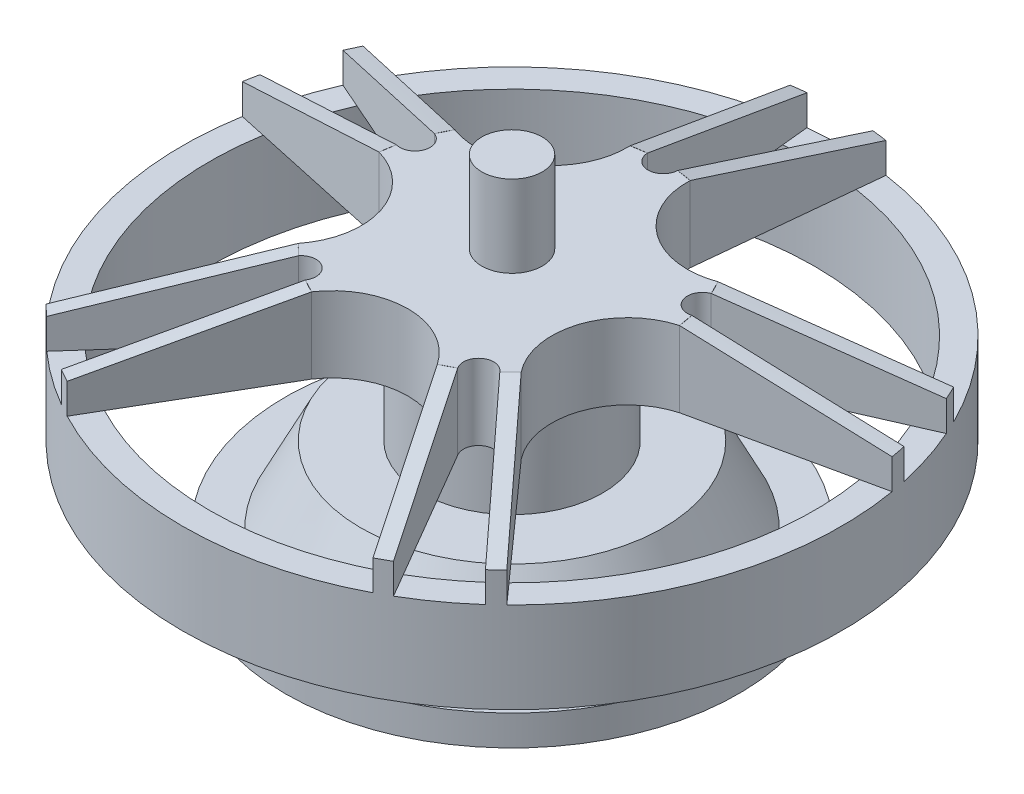
from build123d import *

# Parameters (mm, degrees)
SKETCH_4_R               = 15
EXTRUDE_2_DEPTH          = 2
EXTRUDE_3_DEPTH          = 21.4
EXTRUDE_3_DEPTH_BACK     = 4.1
SKETCH_5_R               = 2
SKETCH_9_W               = 1.8
SKETCH_9_H               = 6
SKETCH_10_R              = 6
SKETCH_10_R_2            = 2
EXTRUDE_5_DEPTH          = 6
SKETCH_11_R              = 2
EXTRUDE_6_DEPTH          = 5
EXTRUDE_7_DEPTH          = 5
PATTERN_START            = 13
PATTERN_CIRCULAR_1_DEPTH = 5


# Read off the part's stored shape, not the designer's step: 阵列(圆周)1
with BuildPart() as part:
    # 草图4 → 凸台-拉伸2 (new body)
    with BuildSketch(Plane(origin=(0, 0, 0), x_dir=(1, 0, 0), z_dir=(0, 1, 0))):
        with Locations(Location((0, 0, 0), (0, 0, 270))):
            Circle(SKETCH_4_R)
    extrude(amount=EXTRUDE_2_DEPTH)

    # 草图5 → 凸台-拉伸3 (add, two sides: drawn at the far end of the back side and taken through both)
    with BuildSketch(Plane(origin=(0, 2, 0), x_dir=(1, 0, 0), z_dir=(0, 1, 0)).offset(-EXTRUDE_3_DEPTH_BACK)):
        with Locations(Location((0, 0, 0), (0, 0, 270))):
            Circle(SKETCH_5_R)
    extrude(amount=EXTRUDE_3_DEPTH + EXTRUDE_3_DEPTH_BACK)

    # 草图8 → 旋转2 (revolve)
    with BuildSketch(Plane.XY, mode=Mode.PRIVATE) as revolve_2_sk:
        Polygon((2, 2), (2, 7), (10, 7), (12.5, 2), align=None)
    revolve(revolve_2_sk.sketch.rotate(Axis((0, 58, 0), (0, -1, 0)), 90), axis=Axis((0, 58, 0), (0, -1, 0)))

    # 草图10 → 凸台-拉伸5 (add)
    with BuildSketch(Plane(origin=(0, 7, 0), x_dir=(1, 0, 0), z_dir=(0, 1, 0))):
        with Locations(Location((0, 0, 0), (0, 0, 90))):
            Circle(SKETCH_10_R)
        with Locations(Location((0, 0, 0), (0, 0, 270))):
            Circle(SKETCH_10_R_2, mode=Mode.SUBTRACT)
    extrude(amount=EXTRUDE_5_DEPTH)

    # 草图11 → 凸台-拉伸6 (add)
    with BuildSketch(Plane(origin=(0, 13, 0), x_dir=(1, 0, 0), z_dir=(0, 1, 0))):
        with BuildLine():
            Line((0.998749218, 9.95), (1.987510943, 9.8005))
            ThreePointArc((1.987510943, 9.8005), (4.045053686, 5.567538761), (8.70665473, 4.918756287))
            Line((8.70665473, 4.918756287), (9.154381856, 4.024586046))
            ThreePointArc((9.154381856, 4.024586046), (8.559508647, 2.781152949), (9.771642819, 2.124852142))
            Line((9.771642819, 2.124852142), (9.935004046, 1.138285819))
            ThreePointArc((9.935004046, 1.138285819), (6.54503435, -2.126610573), (7.368519495, -6.760541432))
            Line((7.368519495, -6.760541432), (6.656468351, -7.462669033))
            ThreePointArc((6.656468351, -7.462669033), (5.290067271, -7.281152949), (5.04045817, -8.636769155))
            Line((5.04045817, -8.636769155), (4.152659235, -9.097000675))
            ThreePointArc((4.152659235, -9.097000675), (0, -6.881856376), (-4.152659235, -9.097000675))
            Line((-4.152659235, -9.097000675), (-5.04045817, -8.636769155))
            ThreePointArc((-5.04045817, -8.636769155), (-5.290067271, -7.281152949), (-6.656468351, -7.462669033))
            Line((-6.656468351, -7.462669033), (-7.368519495, -6.760541432))
            ThreePointArc((-7.368519495, -6.760541432), (-6.54503435, -2.126610573), (-9.935004046, 1.138285819))
            Line((-9.935004046, 1.138285819), (-9.771642819, 2.124852142))
            ThreePointArc((-9.771642819, 2.124852142), (-8.559508647, 2.781152949), (-9.154381856, 4.024586046))
            Line((-9.154381856, 4.024586046), (-8.70665473, 4.918756287))
            ThreePointArc((-8.70665473, 4.918756287), (-4.045053686, 5.567538761), (-1.987510943, 9.8005))
            Line((-1.987510943, 9.8005), (-0.998749218, 9.95))
            ThreePointArc((-0.998749218, 9.95), (0, 9), (0.998749218, 9.95))
        make_face()
        with Locations(Location((0, 0, 0), (0, 0, 270))):
            Circle(SKETCH_11_R, mode=Mode.SUBTRACT)
    extrude(amount=EXTRUDE_6_DEPTH)


with BuildPart() as body_2:
    # 草图9 → 旋转3 (revolve)
    with BuildSketch(Plane.XY, mode=Mode.PRIVATE) as revolve_3_sk:
        with Locations((20.9, 10)):
            Rectangle(SKETCH_9_W, SKETCH_9_H)
    revolve(revolve_3_sk.sketch.rotate(Axis((0, 58, 0), (0, -1, 0)), 90), axis=Axis((0, 58, 0), (0, -1, 0)))

    # 草图13 → 凸台-拉伸7 (add)
    with BuildSketch(Plane.XZ.offset(-13)):
        with BuildLine():
            Line((-6.656468351, 7.462669033), (-14.511101004, 16.268618492))
            ThreePointArc((-14.511101004, 16.268618492), (-14.880055872, 15.931852913), (-15.241197529, 15.586721845))
            Line((-15.241197529, 15.586721845), (-7.368519495, 6.760541432))
            ThreePointArc((-7.368519495, 6.760541432), (-7.02127601, 7.120511442), (-6.656468351, 7.462669033))
        make_face()
        with BuildLine():
            Line((-5.04045817, 8.636769155), (-10.988198811, 18.828156758))
            ThreePointArc((-10.988198811, 18.828156758), (-10.553902387, 19.074987402), (-10.114064327, 19.311802163))
            Line((-10.114064327, 19.311802163), (-4.152659235, 9.097000675))
            ThreePointArc((-4.152659235, 9.097000675), (-4.602315197, 8.877989346), (-5.04045817, 8.636769155))
        make_face()
    extrude(amount=-EXTRUDE_7_DEPTH)

    # 阵列(圆周)1 outline → 阵列(圆周)1 (add)
    with BuildSketch(Plane(origin=(0, 0, 0), x_dir=(1, 0, 0), z_dir=(0, 1, 0)).offset(PATTERN_START)):
        with BuildLine():
            Line((-19.956552445, 8.77359758), (-9.154381856, 4.024586046))
            ThreePointArc((-9.154381856, 4.024586046), (-8.941702415, 4.477271258), (-8.70665473, 4.918756287))
            Line((-8.70665473, 4.918756287), (-19.533642429, 9.67867829))
            ThreePointArc((-19.533642429, 9.67867829), (-19.750282671, 9.228560799), (-19.956552445, 8.77359758))
        make_face()
        with BuildLine():
            Line((-9.771642819, 2.124852142), (-21.302181344, 4.63217767))
            ThreePointArc((-21.302181344, 4.63217767), (-21.402726262, 4.142862363), (-21.492033048, 3.651371724))
            Line((-21.492033048, 3.651371724), (-9.935004046, 1.138285819))
            ThreePointArc((-9.935004046, 1.138285819), (-9.865663228, 1.633612274), (-9.771642819, 2.124852142))
        make_face()
        with BuildLine():
            ThreePointArc((-2.177273295, 21.691), (-2.673709895, 21.635417153), (-3.168742584, 21.568473994))
            Line((-3.168742584, 21.568473994), (-1.987510943, 9.8005))
            ThreePointArc((-1.987510943, 9.8005), (-1.495, 9.887617256), (-0.998749218, 9.95))
            Line((-0.998749218, 9.95), (-2.177273295, 21.691))
        make_face()
        with BuildLine():
            Line((4.152659235, -9.097000675), (10.114064327, -19.311802163))
            ThreePointArc((10.114064327, -19.311802163), (10.553902388, -19.074987402), (10.988198811, -18.828156758))
            Line((10.988198811, -18.828156758), (5.04045817, -8.636769155))
            ThreePointArc((5.04045817, -8.636769155), (4.602315197, -8.877989346), (4.152659235, -9.097000675))
        make_face()
        with BuildLine():
            ThreePointArc((3.168742584, 21.568473994), (2.673709895, 21.635417153), (2.177273295, 21.691))
            Line((2.177273295, 21.691), (0.998749218, 9.95))
            ThreePointArc((0.998749218, 9.95), (1.495, 9.887617256), (1.987510943, 9.8005))
            Line((1.987510943, 9.8005), (3.168742584, 21.568473994))
        make_face()
        with BuildLine():
            Line((6.656468351, -7.462669033), (14.511101004, -16.268618492))
            ThreePointArc((14.511101004, -16.268618492), (14.880055872, -15.931852913), (15.241197529, -15.586721845))
            Line((15.241197529, -15.586721845), (7.368519495, -6.760541432))
            ThreePointArc((7.368519495, -6.760541432), (7.02127601, -7.120511442), (6.656468351, -7.462669033))
        make_face()
        with BuildLine():
            ThreePointArc((19.956552445, 8.77359758), (19.750282671, 9.228560799), (19.533642429, 9.67867829))
            Line((19.533642429, 9.67867829), (8.70665473, 4.918756287))
            ThreePointArc((8.70665473, 4.918756287), (8.941702415, 4.477271258), (9.154381856, 4.024586046))
            Line((9.154381856, 4.024586046), (19.956552445, 8.77359758))
        make_face()
        with BuildLine():
            ThreePointArc((21.492033048, 3.651371724), (21.402726262, 4.142862363), (21.302181344, 4.63217767))
            Line((21.302181344, 4.63217767), (9.771642819, 2.124852142))
            ThreePointArc((9.771642819, 2.124852142), (9.865663228, 1.633612274), (9.935004046, 1.138285819))
            Line((9.935004046, 1.138285819), (21.492033048, 3.651371724))
        make_face()
    extrude(amount=PATTERN_CIRCULAR_1_DEPTH)

    # 草图16 → 切除-旋转1 (revolve, cut)
    with BuildSketch(Plane(origin=(0, 0, 0), x_dir=(0.6656468350603115, 0, -0.7462669033088567), z_dir=(0.7462669033088567, 0, 0.6656468350603115))):
        Polygon((-21.8, 18), (-21.8, 15), (-10, 18), align=None)
    revolve(axis=Axis((0, 58, 0), (0, -1, 0)), mode=Mode.SUBTRACT)


solid = Compound([part.part, body_2.part])
